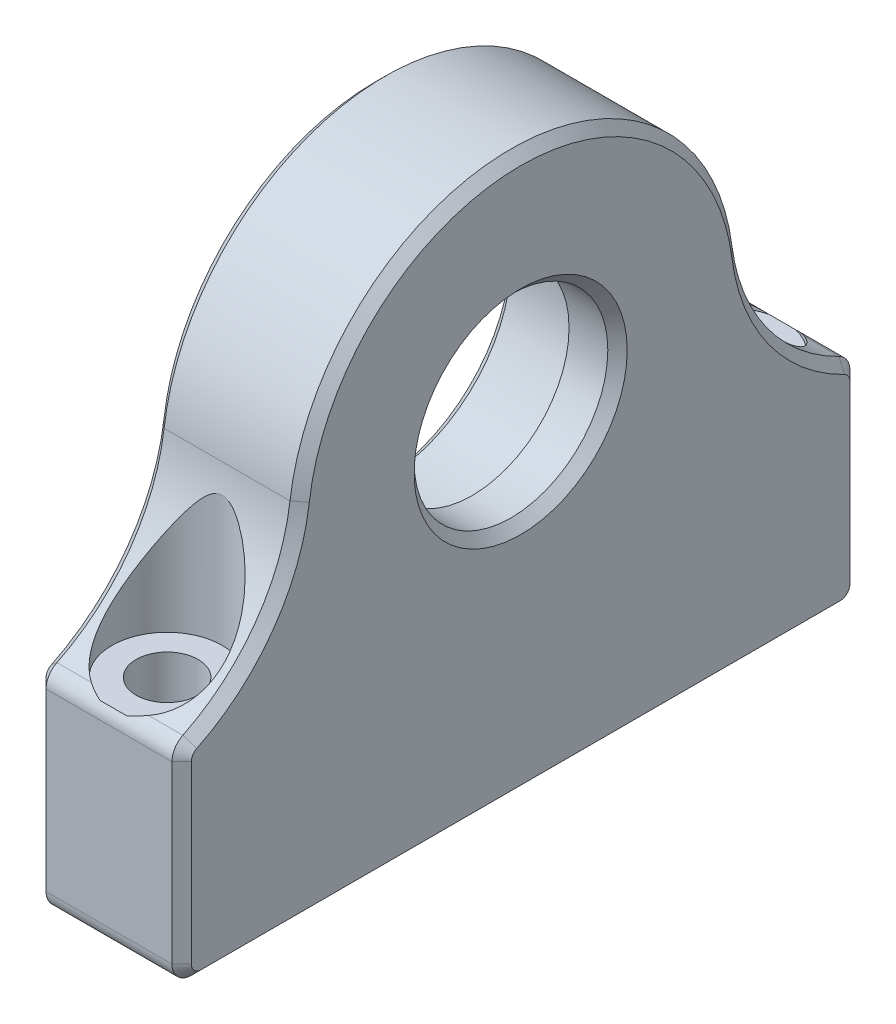
from build123d import *

# Parameters (mm, degrees)
SKETCH1_R           = 6.5
BOSS_EXTRUDE1_DEPTH = 2.5
BOSS_EXTRUDE2_START = 2.5
SKETCH2_R           = 5
BOSS_EXTRUDE2_DEPTH = 2.5
FILLET1_R           = 10
FILLET2_R           = 1
CHAMFER1_SIZE       = 0.5
SKETCH3_R           = 2.85
CUT_EXTRUDE1_DEPTH  = 26.597851472
SKETCH4_R           = 1.6
CUT_EXTRUDE2_DEPTH  = 26.597851541


with BuildPart() as part:
    # Sketch1 → Boss-Extrude1 (new, symmetric)
    with BuildSketch(Plane(origin=(0, 0, 0), x_dir=(0, 0, -1), z_dir=(1, 0, 0))):
        with BuildLine():
            Line((-9.486832981, -6.5), (-17.5, -6.5))
            Line((-17.5, -6.5), (-17.5, -17.2))
            Line((-17.5, -17.2), (17.5, -17.2))
            Line((17.5, -17.2), (17.5, -6.5))
            Line((17.5, -6.5), (9.486832981, -6.5))
            ThreePointArc((9.486832981, -6.5), (0, 11.5), (-9.486832981, -6.5))
        make_face()
        Circle(SKETCH1_R, mode=Mode.SUBTRACT)
    extrude(amount=BOSS_EXTRUDE1_DEPTH, both=True)

    # Sketch2 → Boss-Extrude2 (add)
    with BuildSketch(Plane(origin=(2.5, 0, 0), x_dir=(0, 0, -1), z_dir=(1, 0, 0)).offset(BOSS_EXTRUDE2_START)):
        with BuildLine():
            Line((-9.486832981, -6.5), (-17.5, -6.5))
            Line((-17.5, -6.5), (-17.5, -17.2))
            Line((-17.5, -17.2), (17.5, -17.2))
            Line((17.5, -17.2), (17.5, -6.5))
            Line((17.5, -6.5), (9.486832981, -6.5))
            ThreePointArc((9.486832981, -6.5), (0, 11.5), (-9.486832981, -6.5))
        make_face()
        Circle(SKETCH2_R, mode=Mode.SUBTRACT)
    extrude(amount=-BOSS_EXTRUDE2_DEPTH)

    # Fillet1
    # the kernel refuses this fillet: 10 mm, written as the material it adds along each edge
    with BuildSketch(Plane(origin=(5, -6.5, 9.486832981), x_dir=(0, 0, 1), z_dir=(-1, 0, 0))) as fillet1_piece_1:
        with BuildLine():
            CenterArc((11.837899914, 9.239665486), FILLET1_R, 187.320893322, 60.192138393)
            Line((1.919419498, 7.965402469), (1.72104989, 7.939917209))
            ThreePointArc((1.72104989, 7.939917209), (1.498721871, 3.852815723), (-0.1649884, 0.113043478))
            Line((-0.1649884, 0.113043478), (0, -0.2))
            ThreePointArc((0, -0.2), (4.00658351, -0.2), (7.936672362, -0.18479331))
            Line((7.936672362, -0.18479331), (8.013167019, 0))
        make_face()
    extrude(amount=7.5)
    with BuildSketch(Plane(origin=(5, -6.5, -9.486832981), x_dir=(0, 0.9721729957330114, -0.23426409534434056), z_dir=(-1, 0, 0))) as fillet1_piece_2:
        with BuildLine():
            CenterArc((11.755748189, 9.343964746), FILLET1_R, 188.938720591, 60.192138393)
            Line((1.877197323, 7.790184587), (1.679626305, 7.759108983))
            ThreePointArc((1.679626305, 7.759108983), (0.744164062, 3.941945112), (-0.194434599, 0.046852819))
            Line((-0.194434599, 0.046852819), (0.071246959, -0.186879295))
            ThreePointArc((0.071246959, -0.186879295), (4.096700126, 0.554440542), (8.122153294, -0.186879295))
            Line((8.122153294, -0.186879295), (8.193400253, 0))
        make_face()
    extrude(amount=7.5)

    # Fillet2
    fillet2_edges = [part.edges().sort_by_distance(p)[0] for p in [
        (1.25, -6.5, -17.5),
        (1.25, -17.2, -17.5),
        (1.25, -17.2, 17.5),
        (1.25, -6.5, 17.5),
    ]]
    fillet(fillet2_edges, radius=FILLET2_R)

    # Chamfer1
    chamfer1_edges = [part.edges().sort_by_distance(p)[0] for p in [
        (-2.5, 0, 6.5),
        (5, 0, 5),
        (-2.5, 11.5, 0),
        (5, 11.5, 0),
        (-2.5, -3.089050017, -13.199089807),
        (5, -3.089050017, 13.199089807),
        (-2.5, -11.672887978, -17.5),
        (5, -11.672887978, -17.5),
        (-2.5, -17.2, 0),
        (-2.5, -11.672887978, 17.5),
        (-2.5, -3.089050017, 13.199089807),
        (-2.5, -6.61597037, 17.348119119),
        (-2.5, -16.907106781, 17.207106781),
        (-2.5, -6.61597037, -17.348119119),
        (-2.5, -16.907106781, -17.207106781),
        (5, -17.2, 0),
        (5, -3.089050017, -13.199089807),
        (5, -11.672887978, 17.5),
        (5, -6.61597037, 17.348119119),
        (5, -16.907106781, 17.207106781),
        (5, -6.61597037, -17.348119119),
        (5, -16.907106781, -17.207106781),
    ]]
    chamfer(chamfer1_edges, length=CHAMFER1_SIZE)

    # Sketch3 → Cut-Extrude1 (cut, through all)
    with BuildSketch(Plane(origin=(0, -6.5, 0), x_dir=(1, 0, 0), z_dir=(0, 1, 0))):
        with Locations((1.25, -14.5)):
            Circle(SKETCH3_R)
    cut_extrude1 = extrude(amount=CUT_EXTRUDE1_DEPTH, mode=Mode.SUBTRACT)

    # Sketch4 → Cut-Extrude2 (cut, through all)
    with BuildSketch(Plane(origin=(0, -6.5, 0), x_dir=(1, 0, 0), z_dir=(0, 1, 0))):
        with Locations(Location((1.25, -14.5, 0), (0, 0, 270))):
            Circle(SKETCH4_R)
    cut_extrude2 = extrude(amount=-CUT_EXTRUDE2_DEPTH, mode=Mode.SUBTRACT)

    # Mirror1: Cut-Extrude1, Cut-Extrude2 across plane
    add(cut_extrude1.mirror(Plane.XY), mode=Mode.SUBTRACT)
    add(cut_extrude2.mirror(Plane.XY), mode=Mode.SUBTRACT)


solid = part.part
